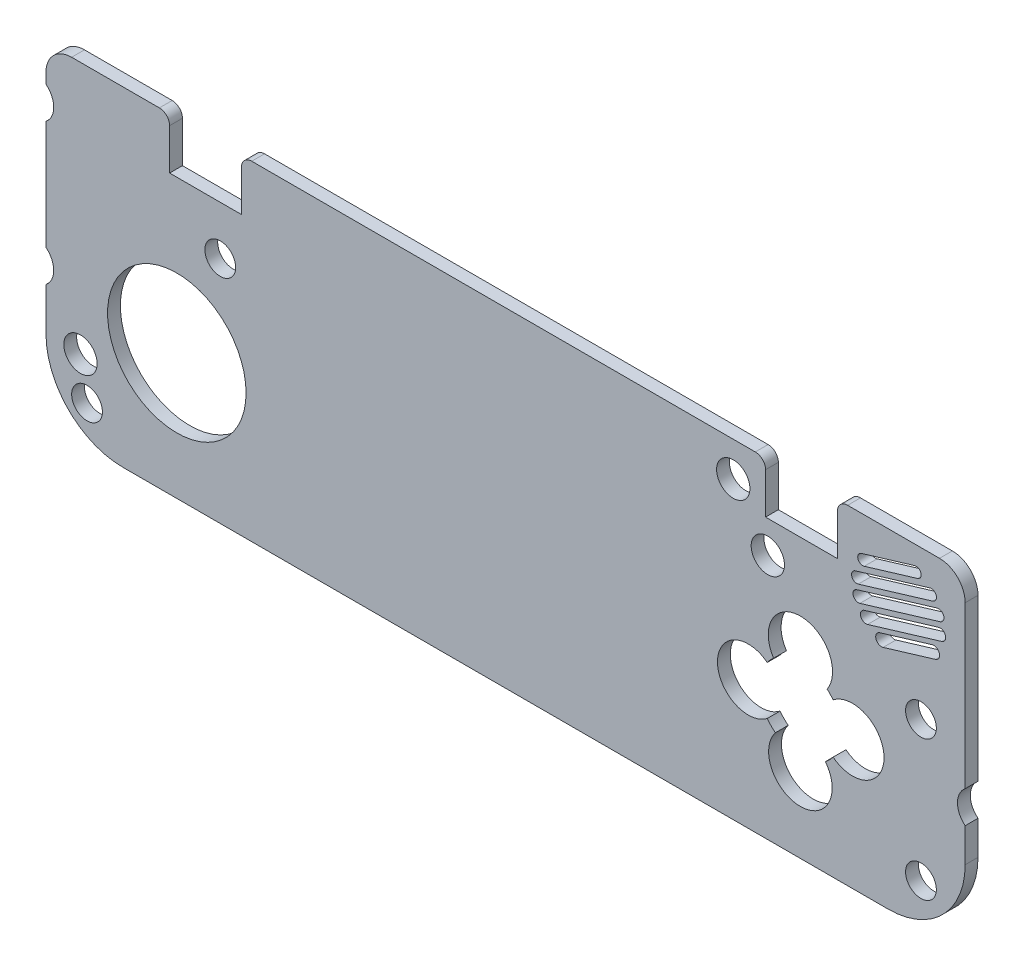
from build123d import *

# Parameters (mm, degrees)
BOSS_EXTRU_1_DEPTH       = 2.5
ENL_V_MAT_EXTRU_14_DEPTH = 10
JOYSTICK_R               = 13.5
ENL_V_MAT_EXTRU_2_DEPTH  = 2.5
ESQUISSE2_W              = 14
ESQUISSE2_H              = 10
ENL_V_MAT_EXTRU_3_DEPTH  = 10
CONG_1_R                 = 2
CONG_2_R                 = 2
ESQUISSE3_W              = 14
ESQUISSE3_H              = 10
ENL_V_MAT_EXTRU_4_DEPTH  = 10
CONG_3_R                 = 2
CONG_4_R                 = 2
ENL_V_MAT_EXTRU_8_DEPTH  = 10
ESQUISSE5_R              = 3
ESQUISSE5_R_2            = 3.25
ENL_V_MAT_EXTRU_9_DEPTH  = 10
ESQUISSE6_R              = 4
ENL_V_MAT_EXTRU_15_DEPTH = 10


with BuildPart() as part:
    # Esquisse1 → Boss.-Extru.1 (new body)
    with BuildSketch(Plane.XY):
        with BuildLine():
            Line((-89.203921136, 33.34478673), (79.966078864, 33.34478673))
            ThreePointArc((79.966078864, 33.34478673), (83.50161277, 31.880320636), (84.966078864, 28.34478673))
            Line((84.966078864, 28.34478673), (84.966078864, -15.88521327))
            ThreePointArc((84.966078864, -15.88521327), (80.572680581, -26.491814988), (69.966078864, -30.88521327))
            Line((69.966078864, -30.88521327), (-79.203921136, -30.88521327))
            ThreePointArc((-79.203921136, -30.88521327), (-89.810522854, -26.491814988), (-94.203921136, -15.88521327))
            Line((-94.203921136, -15.88521327), (-94.203921136, 28.34478673))
            ThreePointArc((-94.203921136, 28.34478673), (-92.739455042, 31.880320636), (-89.203921136, 33.34478673))
        make_face()
    extrude(amount=BOSS_EXTRU_1_DEPTH)

    # 12x12 Button → Enlèv. mat.-Extru.14 (cut)
    with BuildSketch(Plane.XY.offset(2.5)):
        with BuildLine():
            ThreePointArc((59.220398192, -0.921151245), (58.674503702, -0.275289323), (58.063482277, 0.309339821))
            ThreePointArc((58.063482276, 0.309339821), (52.849240894, 10.038221143), (47.62517912, 0.314609492))
            ThreePointArc((47.62517912, 0.314609491), (46.965240695, -0.322324083), (46.382477581, -1.030554452))
            ThreePointArc((46.382477581, -1.030554452), (36.687266101, -5.758353734), (46.387422405, -10.475999265))
            ThreePointArc((46.387422405, -10.475999265), (47.121070973, -11.343088385), (47.970121608, -12.097539697))
            ThreePointArc((47.970121608, -12.097539697), (52.846080853, -22.107917903), (57.722033666, -12.097536564))
            ThreePointArc((57.722033666, -12.097536564), (58.521539603, -11.393399627), (59.220393145, -10.589271343))
            ThreePointArc((59.220393145, -10.589271343), (69.146073474, -5.755216476), (59.220398192, -0.921151245))
        make_face()
    extrude(amount=-ENL_V_MAT_EXTRU_14_DEPTH, mode=Mode.SUBTRACT)

    # Joystick → Enlèv. mat.-Extru.2 (cut)
    with BuildSketch(Plane.XY.offset(2.5)):
        with Locations((-68.703921136, -6.32521327)):
            Circle(JOYSTICK_R)
    extrude(amount=-ENL_V_MAT_EXTRU_2_DEPTH, mode=Mode.SUBTRACT)

    # Esquisse2 → Enlèv. mat.-Extru.3 (cut)
    with BuildSketch(Plane.XY.offset(2.5)):
        with Locations((53.056078864, 28.34478673)):
            Rectangle(ESQUISSE2_W, ESQUISSE2_H)
    extrude(amount=-ENL_V_MAT_EXTRU_3_DEPTH, mode=Mode.SUBTRACT)

    # Congé1
    cong_1_edges = [part.edges().sort_by_distance(p)[0] for p in [
        (46.056078864, 33.34478673, 1.25),
    ]]
    fillet(cong_1_edges, radius=CONG_1_R)

    # Congé2
    cong_2_edges = [part.edges().sort_by_distance(p)[0] for p in [
        (60.056078864, 33.34478673, 1.25),
    ]]
    fillet(cong_2_edges, radius=CONG_2_R)

    # Esquisse3 → Enlèv. mat.-Extru.4 (cut)
    with BuildSketch(Plane.XY.offset(2.5)):
        with Locations((-63.103921136, 28.34478673)):
            Rectangle(ESQUISSE3_W, ESQUISSE3_H)
    extrude(amount=-ENL_V_MAT_EXTRU_4_DEPTH, mode=Mode.SUBTRACT)

    # Congé3
    cong_3_edges = [part.edges().sort_by_distance(p)[0] for p in [
        (-70.103921136, 33.34478673, 1.25),
    ]]
    fillet(cong_3_edges, radius=CONG_3_R)

    # Congé4
    cong_4_edges = [part.edges().sort_by_distance(p)[0] for p in [
        (-56.103921136, 33.34478673, 1.25),
    ]]
    fillet(cong_4_edges, radius=CONG_4_R)

    # Esquisse4 → Enlèv. mat.-Extru.8 (cut)
    with BuildSketch(Plane.XY.offset(2.5)):
        with BuildLine():
            ThreePointArc((63.848163441, 19.991775112), (63.146749084, 18.684402623), (64.454121573, 17.982988266))
            Line((64.454121573, 17.982988266), (80.083994286, 22.697798347))
            ThreePointArc((80.083994286, 22.697798347), (80.785408643, 24.005170837), (79.478036154, 24.706585194))
            Line((79.478036154, 24.706585194), (63.848163441, 19.991775112))
        make_face()
        with BuildLine():
            ThreePointArc((63.539756046, 23.02230266), (62.859334743, 21.754059311), (64.127578092, 21.073638007))
            Line((64.127578092, 21.073638007), (78.646973349, 25.453468374))
            ThreePointArc((78.646973349, 25.453468374), (79.327394653, 26.721711723), (78.059151304, 27.402133027))
            Line((78.059151304, 27.402133027), (63.539756046, 23.02230266))
        make_face()
        with BuildLine():
            ThreePointArc((65.314724126, 17.237366416), (64.591788009, 15.889879327), (65.939275099, 15.166943211))
            Line((65.939275099, 15.166943211), (80.403820915, 19.530228036))
            ThreePointArc((80.403820915, 19.530228036), (81.126757031, 20.877715126), (79.779269942, 21.600651242))
            Line((79.779269942, 21.600651242), (65.314724126, 17.237366416))
        make_face()
        with BuildLine():
            ThreePointArc((64.721267087, 26.554024385), (64.061810556, 25.324857462), (65.290977478, 24.665400931))
            Line((65.290977478, 24.665400931), (75.691438685, 27.802739299))
            ThreePointArc((75.691438685, 27.802739299), (76.350895216, 29.031906221), (75.121728293, 29.691362753))
            Line((75.121728293, 29.691362753), (64.721267087, 26.554024385))
        make_face()
        with BuildLine():
            ThreePointArc((68.322797362, 14.963301678), (67.571229601, 13.562447811), (68.972083468, 12.810880049))
            Line((68.972083468, 12.810880049), (79.179793957, 15.890074436))
            ThreePointArc((79.179793957, 15.890074436), (79.931361718, 17.290928304), (78.530507851, 18.042496065))
            Line((78.530507851, 18.042496065), (68.322797362, 14.963301678))
        make_face()
    extrude(amount=-ENL_V_MAT_EXTRU_8_DEPTH, mode=Mode.SUBTRACT)

    # Esquisse5 → Enlèv. mat.-Extru.9 (cut)
    with BuildSketch(Plane.XY.offset(2.5)):
        with Locations((76.346078864, -22.88521327)):
            Circle(ESQUISSE5_R)
        with Locations((-86.203921136, -23.53521327)):
            Circle(ESQUISSE5_R)
        with Locations((76.346078864, 4.34478673)):
            Circle(ESQUISSE5_R)
        with Locations((-60.233921136, 13.83478673)):
            Circle(ESQUISSE5_R)
        with Locations((-87.483921136, -15.91521327)):
            Circle(ESQUISSE5_R_2)
        with Locations((39.756078864, 26.62478673)):
            Circle(ESQUISSE5_R_2)
        with Locations((46.496078864, 17.10478673)):
            Circle(ESQUISSE5_R_2)
    extrude(amount=-ENL_V_MAT_EXTRU_9_DEPTH, mode=Mode.SUBTRACT)

    # Esquisse6 → Enlèv. mat.-Extru.15 (cut)
    with BuildSketch(Plane.XY.offset(2.5)):
        with Locations((-96.703921136, -4.38521327)):
            Circle(ESQUISSE6_R)
        with Locations((-96.703921136, 23.15478673)):
            Circle(ESQUISSE6_R)
        with Locations((87.466078864, -6.16521327)):
            Circle(ESQUISSE6_R)
    extrude(amount=-ENL_V_MAT_EXTRU_15_DEPTH, mode=Mode.SUBTRACT)


solid = part.part
